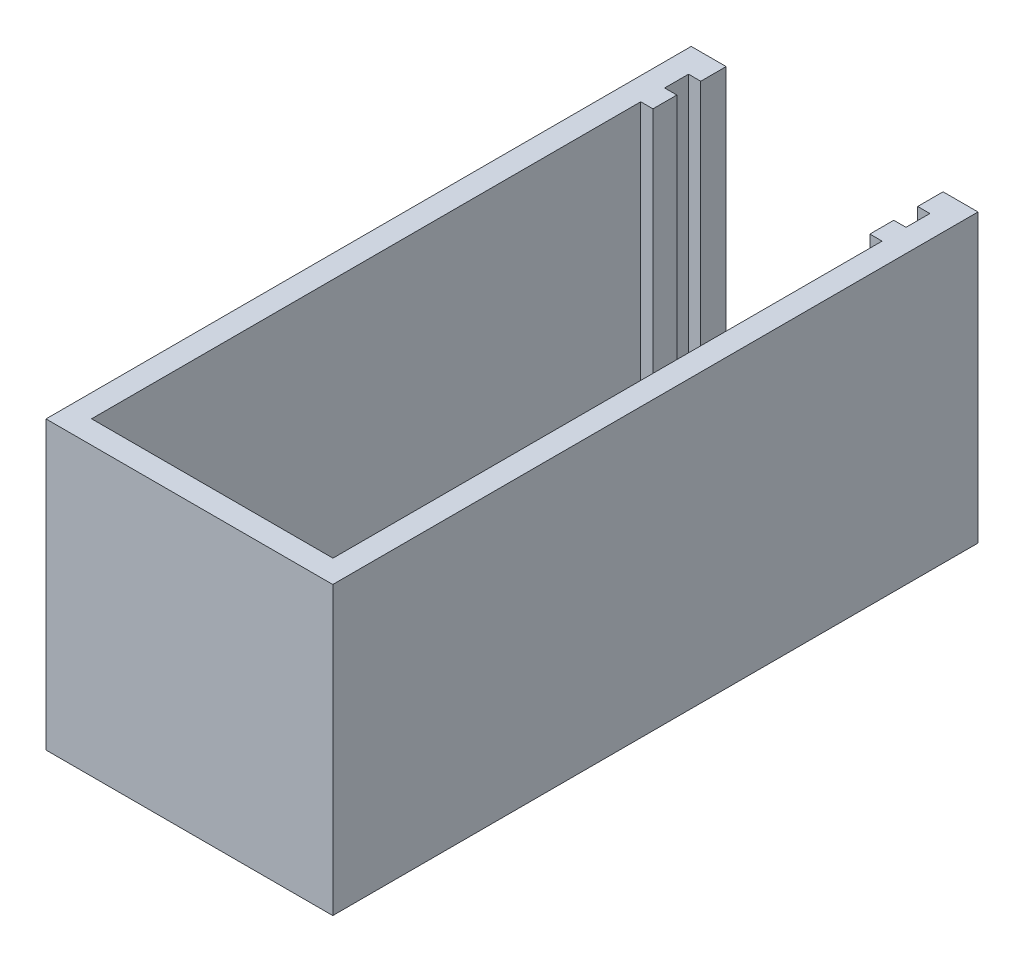
from build123d import *

# Parameters (mm, degrees)
BOSS_EXTRUDE1_DEPTH     = 12
CUT_EXTRUDE1_DEPTH      = 31.149626863
CUT_EXTRUDE1_DEPTH_BACK = 11
SKETCH3_W               = 9.076894886
SKETCH3_H               = 11
CUT_EXTRUDE2_DEPTH      = 11


with BuildPart() as part:
    # Sketch1 → Boss-Extrude1 (new body)
    with BuildSketch(Plane(origin=(0, 0, 0), x_dir=(1, 0, 0), z_dir=(0, 1, 0))):
        Polygon((0, 0), (-6, 0), (-6, -27), (6, -27), (6, 0), align=None)
    extrude(amount=BOSS_EXTRUDE1_DEPTH)

    # Sketch2 → Cut-Extrude1 (cut, two sides: drawn at the far end of the back side and taken through both)
    with BuildSketch(Plane(origin=(0, 12, 0), x_dir=(1, 0, 0), z_dir=(0, 1, 0)).offset(-CUT_EXTRUDE1_DEPTH_BACK)):
        Polygon((-5.05, -1.063246735), (5.05, -1.063246735), (5.05, -2.063246735), (4.538447443, -2.063246735), (4.538447443, -3.063246735), (5.05, -3.063246735), (5.05, -26.042298554), (-5.05, -26.042298554), (-5.05, -3.063246735), (-4.538447443, -3.063246735), (-4.538447443, -2.063246735), (-5.05, -2.063246735), align=None)
    extrude(amount=CUT_EXTRUDE1_DEPTH + CUT_EXTRUDE1_DEPTH_BACK, mode=Mode.SUBTRACT)

    # Sketch3 → Cut-Extrude2 (cut)
    with BuildSketch(Plane(origin=(0, 0, 0), x_dir=(-1, 0, 0), z_dir=(0, 0, -1))):
        with Locations((0, 6.5)):
            Rectangle(SKETCH3_W, SKETCH3_H)
    extrude(amount=-CUT_EXTRUDE2_DEPTH, mode=Mode.SUBTRACT)


solid = part.part
